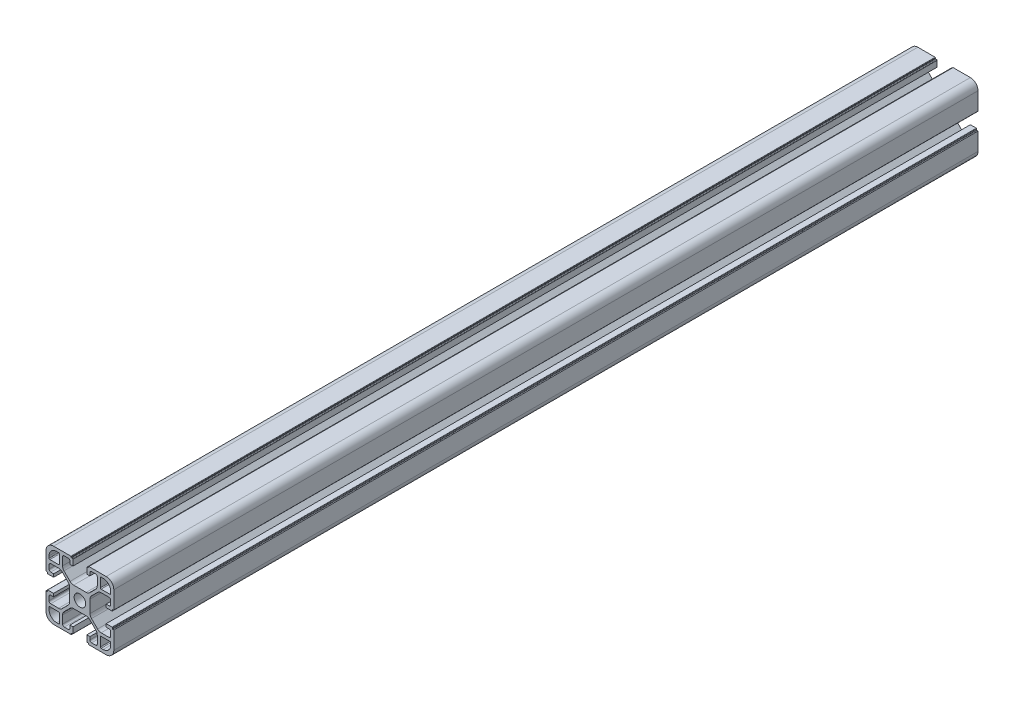
from build123d import *

# Parameters (mm, degrees)
SKETCH1_W                = 40
SKETCH1_H                = 40
BOSS_EXTRUDE1_DEPTH      = 510
SKETCH2_R                = 3.4
CUT_EXTRUDE1_DEPTH       = 511.783711565
CUT_EXTRUDE2_DEPTH       = 511.783711565
FILLET1_R                = 1
SKETCH4_W                = 10.2
SKETCH4_H                = 0.8
CUT_EXTRUDE3_DEPTH       = 511.783711565
FILLET3_R                = 0.2
CIRPATTERN1_DEPTH        = 510
FILLET4_R                = 4.5
CUT_EXTRUDE4_DEPTH       = 511.783711565
FILLET6_R                = 0.5
CIRPATTERN2_COUNT        = 4
FILLET6_OF_CIRPATTERN2_R = 0.5
FILLET5_R                = 3


# Read off the part's stored shape, not the designer's step: CirPattern1
with BuildPart() as part:
    # Sketch1 → Boss-Extrude1 (new body)
    with BuildSketch(Plane.XY):
        Rectangle(SKETCH1_W, SKETCH1_H)
    extrude(amount=BOSS_EXTRUDE1_DEPTH)

    # Sketch2 → Cut-Extrude1 (cut, through all)
    with BuildSketch(Plane(origin=(0, 0, 0), x_dir=(-1, 0, 0), z_dir=(0, 0, -1))):
        Circle(SKETCH2_R)
    extrude(amount=-CUT_EXTRUDE1_DEPTH, mode=Mode.SUBTRACT)

    # Sketch3 → Cut-Extrude2 (cut, through all)
    with BuildSketch(Plane(origin=(0, 0, 0), x_dir=(-1, 0, 0), z_dir=(0, 0, -1))):
        Polygon((10.25, 18.2), (10.25, 11.310660172), (4.939339828, 6), (-4.939339828, 6), (-10.25, 11.310660172), (-10.25, 18.2), (-5.9, 18.2), (-5.9, 15.5), (-4.1, 15.5), (-4.1, 20), (4.1, 20), (4.1, 15.5), (5.9, 15.5), (5.9, 18.2), align=None)
    extrude(amount=-CUT_EXTRUDE2_DEPTH, mode=Mode.SUBTRACT)

    # Fillet1
    fillet1_edges = [part.edges().sort_by_distance(p)[0] for p in [
        (10.25, 18.2, 255),
        (5.9, 18.2, 255),
        (-5.9, 18.2, 255),
        (-10.25, 18.2, 255),
    ]]
    fillet(fillet1_edges, radius=FILLET1_R)

    # Sketch4 → Cut-Extrude3 (cut, symmetric)
    with BuildSketch(Plane(origin=(0, 0, 0), x_dir=(-1, 0, 0), z_dir=(0, 0, -1))):
        with Locations((0, 19.6)):
            Rectangle(SKETCH4_W, SKETCH4_H)
    extrude(amount=CUT_EXTRUDE3_DEPTH, both=True, mode=Mode.SUBTRACT)

    # Fillet3
    fillet3_edges = [part.edges().sort_by_distance(p)[0] for p in [
        (5.1, 19.2, 255),
        (-5.1, 20, 255),
        (5.1, 20, 255),
        (4.1, 19.2, 255),
        (-5.1, 19.2, 255),
        (-4.1, 19.2, 255),
    ]]
    fillet(fillet3_edges, radius=FILLET3_R)

    # CirPattern1 outline → CirPattern1 (cut)
    with BuildSketch(Plane.XY):
        with BuildLine():
            Line((4.1, -15.5), (5.9, -15.5))
            Line((5.9, -15.5), (5.9, -17.2))
            ThreePointArc((5.9, -17.2), (6.192893219, -17.907106781), (6.9, -18.2))
            Line((6.9, -18.2), (9.25, -18.2))
            ThreePointArc((9.25, -18.2), (9.957106781, -17.907106781), (10.25, -17.2))
            Line((10.25, -17.2), (10.25, -11.310660172))
            Line((10.25, -11.310660172), (4.939339828, -6))
            Line((4.939339828, -6), (-4.939339828, -6))
            Line((-4.939339828, -6), (-10.25, -11.310660172))
            Line((-10.25, -11.310660172), (-10.25, -17.2))
            ThreePointArc((-10.25, -17.2), (-9.957106781, -17.907106781), (-9.25, -18.2))
            Line((-9.25, -18.2), (-6.9, -18.2))
            ThreePointArc((-6.9, -18.2), (-6.192893219, -17.907106781), (-5.9, -17.2))
            Line((-5.9, -17.2), (-5.9, -15.5))
            Line((-5.9, -15.5), (-4.1, -15.5))
            Line((-4.1, -15.5), (-4.1, -19))
            ThreePointArc((-4.1, -19), (-4.158578644, -19.141421356), (-4.3, -19.2))
            Line((-4.3, -19.2), (-4.9, -19.2))
            ThreePointArc((-4.9, -19.2), (-5.041421356, -19.258578644), (-5.1, -19.4))
            Line((-5.1, -19.4), (-5.1, -20))
            Line((-5.1, -20), (5.1, -20))
            Line((5.1, -20), (5.1, -19.4))
            ThreePointArc((5.1, -19.4), (5.041421356, -19.258578644), (4.9, -19.2))
            Line((4.9, -19.2), (4.3, -19.2))
            ThreePointArc((4.3, -19.2), (4.158578644, -19.141421356), (4.1, -19))
            Line((4.1, -19), (4.1, -15.5))
        make_face()
        with BuildLine():
            Line((19.4, -5.1), (20, -5.1))
            Line((20, -5.1), (20, 5.1))
            Line((20, 5.1), (19.4, 5.1))
            ThreePointArc((19.4, 5.1), (19.258578644, 5.041421356), (19.2, 4.9))
            Line((19.2, 4.9), (19.2, 4.3))
            ThreePointArc((19.2, 4.3), (19.141421356, 4.158578644), (19, 4.1))
            Line((19, 4.1), (15.5, 4.1))
            Line((15.5, 4.1), (15.5, 5.9))
            Line((15.5, 5.9), (17.2, 5.9))
            ThreePointArc((17.2, 5.9), (17.907106781, 6.192893219), (18.2, 6.9))
            Line((18.2, 6.9), (18.2, 9.25))
            ThreePointArc((18.2, 9.25), (17.907106781, 9.957106781), (17.2, 10.25))
            Line((17.2, 10.25), (11.310660172, 10.25))
            Line((11.310660172, 10.25), (6, 4.939339828))
            Line((6, 4.939339828), (6, -4.939339828))
            Line((6, -4.939339828), (11.310660172, -10.25))
            Line((11.310660172, -10.25), (17.2, -10.25))
            ThreePointArc((17.2, -10.25), (17.907106781, -9.957106781), (18.2, -9.25))
            Line((18.2, -9.25), (18.2, -6.9))
            ThreePointArc((18.2, -6.9), (17.907106781, -6.192893219), (17.2, -5.9))
            Line((17.2, -5.9), (15.5, -5.9))
            Line((15.5, -5.9), (15.5, -4.1))
            Line((15.5, -4.1), (19, -4.1))
            ThreePointArc((19, -4.1), (19.141421356, -4.158578644), (19.2, -4.3))
            Line((19.2, -4.3), (19.2, -4.9))
            ThreePointArc((19.2, -4.9), (19.258578644, -5.041421356), (19.4, -5.1))
        make_face()
        with BuildLine():
            Line((-20, 5.1), (-20, -5.1))
            Line((-20, -5.1), (-19.4, -5.1))
            ThreePointArc((-19.4, -5.1), (-19.258578644, -5.041421356), (-19.2, -4.9))
            Line((-19.2, -4.9), (-19.2, -4.3))
            ThreePointArc((-19.2, -4.3), (-19.141421356, -4.158578644), (-19, -4.1))
            Line((-19, -4.1), (-15.5, -4.1))
            Line((-15.5, -4.1), (-15.5, -5.9))
            Line((-15.5, -5.9), (-17.2, -5.9))
            ThreePointArc((-17.2, -5.9), (-17.907106781, -6.192893219), (-18.2, -6.9))
            Line((-18.2, -6.9), (-18.2, -9.25))
            ThreePointArc((-18.2, -9.25), (-17.907106781, -9.957106781), (-17.2, -10.25))
            Line((-17.2, -10.25), (-11.310660172, -10.25))
            Line((-11.310660172, -10.25), (-6, -4.939339828))
            Line((-6, -4.939339828), (-6, 4.939339828))
            Line((-6, 4.939339828), (-11.310660172, 10.25))
            Line((-11.310660172, 10.25), (-17.2, 10.25))
            ThreePointArc((-17.2, 10.25), (-17.907106781, 9.957106781), (-18.2, 9.25))
            Line((-18.2, 9.25), (-18.2, 6.9))
            ThreePointArc((-18.2, 6.9), (-17.907106781, 6.192893219), (-17.2, 5.9))
            Line((-17.2, 5.9), (-15.5, 5.9))
            Line((-15.5, 5.9), (-15.5, 4.1))
            Line((-15.5, 4.1), (-19, 4.1))
            ThreePointArc((-19, 4.1), (-19.141421356, 4.158578644), (-19.2, 4.3))
            Line((-19.2, 4.3), (-19.2, 4.9))
            ThreePointArc((-19.2, 4.9), (-19.258578644, 5.041421356), (-19.4, 5.1))
            Line((-19.4, 5.1), (-20, 5.1))
        make_face()
    extrude(amount=CIRPATTERN1_DEPTH, mode=Mode.SUBTRACT)

    # Fillet4
    fillet4_edges = [part.edges().sort_by_distance(p)[0] for p in [
        (20, -20, 255),
        (-20, -20, 255),
        (-20, 20, 255),
        (20, 20, 255),
    ]]
    fillet(fillet4_edges, radius=FILLET4_R)

    # Sketch6 → Cut-Extrude4 (cut, through all)
    with BuildSketch(Plane(origin=(0, 0, 0), x_dir=(-1, 0, 0), z_dir=(0, 0, -1))):
        with BuildLine():
            Line((-12.05, 12.05), (-18.2, 12.05))
            Line((-18.2, 12.05), (-18.2, 13.7))
            ThreePointArc((-18.2, 13.7), (-16.881980515, 16.881980515), (-13.7, 18.2))
            Line((-13.7, 18.2), (-12.05, 18.2))
            Line((-12.05, 18.2), (-12.05, 12.05))
        make_face()
    cut_extrude4 = extrude(amount=-CUT_EXTRUDE4_DEPTH, mode=Mode.SUBTRACT)

    # Fillet6
    fillet6_edges = [part.edges().sort_by_distance(p)[0] for p in [
        (12.05, 18.2, 255),
        (12.05, 12.05, 255),
        (18.2, 12.05, 255),
    ]]
    fillet(fillet6_edges, radius=FILLET6_R)

    # CirPattern2: Cut-Extrude4 ×4 about axis
    cirpattern2_axis = Axis((0, 0, 0), (0, 0, 1))
    for i in range(1, CIRPATTERN2_COUNT):
        add(cut_extrude4.rotate(cirpattern2_axis, i * 360 / CIRPATTERN2_COUNT), mode=Mode.SUBTRACT)

    # Fillet6 of CirPattern2
    fillet6_of_cirpattern2_edges = [part.edges().sort_by_distance(p)[0] for p in [
        (-18.2, 12.05, 255),
        (-12.05, 12.05, 255),
        (-12.05, 18.2, 255),
        (-12.05, -18.2, 255),
        (-12.05, -12.05, 255),
        (-18.2, -12.05, 255),
        (18.2, -12.05, 255),
        (12.05, -12.05, 255),
        (12.05, -18.2, 255),
    ]]
    fillet(fillet6_of_cirpattern2_edges, radius=FILLET6_OF_CIRPATTERN2_R)

    # Fillet5
    fillet5_edges = [part.edges().sort_by_distance(p)[0] for p in [
        (10.25, -11.310660172, 255),
        (4.939339828, -6, 255),
        (-4.939339828, -6, 255),
        (-10.25, -11.310660172, 255),
        (-11.310660172, -10.25, 255),
        (-6, -4.939339828, 255),
        (-6, 4.939339828, 255),
        (-11.310660172, 10.25, 255),
        (11.310660172, 10.25, 255),
        (6, 4.939339828, 255),
        (6, -4.939339828, 255),
        (11.310660172, -10.25, 255),
        (-10.25, 11.310660172, 255),
        (-4.939339828, 6, 255),
        (4.939339828, 6, 255),
        (10.25, 11.310660172, 255),
    ]]
    fillet(fillet5_edges, radius=FILLET5_R)


solid = part.part
